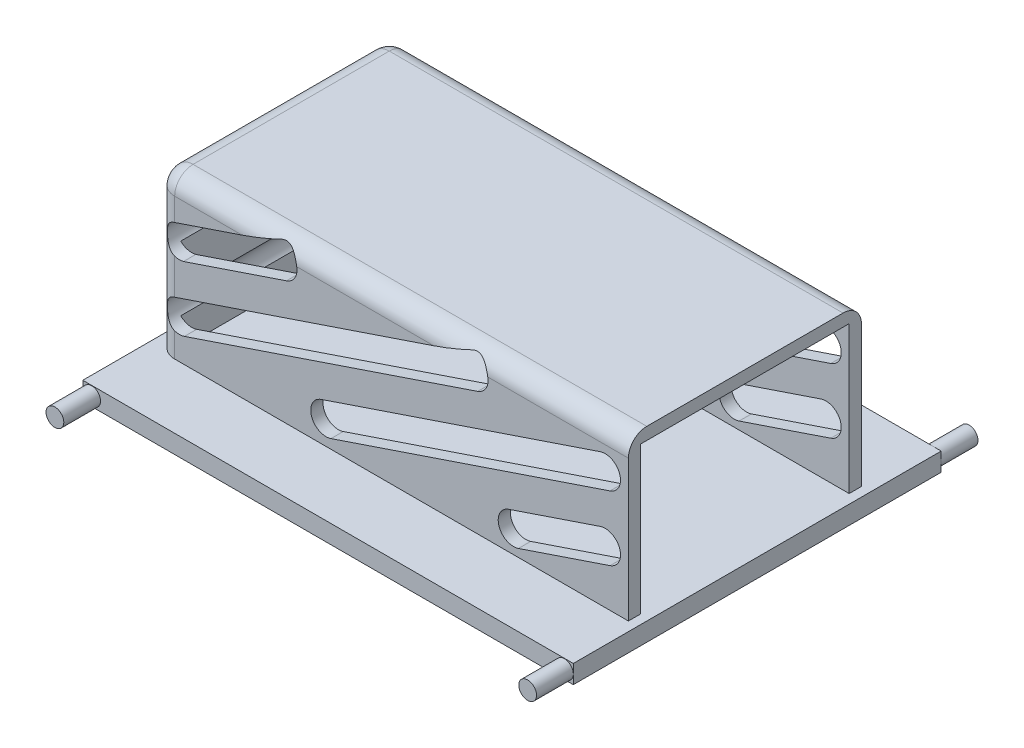
from build123d import *

# Parameters (mm, degrees)
EXTRUDE_1_DEPTH      = 55.815
EXTRUDE_1_DEPTH_BACK = 4.185
EXTRUDE_4_DEPTH      = 24
SKETCH_13_R          = 1.45
EXTRUDE_5_DEPTH      = 6
EXTRUDE_START        = 6
SKETCH_14_R          = 1.45
EXTRUDE_6_DEPTH      = 6
SKETCH_15_W          = 77
SKETCH_15_H          = 37.999949308
EXTRUDE_7_DEPTH      = 2
CUT_EXTRUDE_2_DEPTH  = 38
FILLET_2_R           = 3
FILLET_3_R           = 3
FILLET_4_R           = 3


with BuildPart() as part:
    # 草图1 → 凸台-拉伸1 (new, two sides: drawn at the far end of the back side and taken through both)
    with BuildSketch(Plane.XY.offset(-EXTRUDE_1_DEPTH_BACK)):
        Polygon((0, 1.5), (30, 1.5), (40, 1.5), (40, -1.5), (-40, -1.5), (-40, 1.5), align=None)
    extrude(amount=EXTRUDE_1_DEPTH + EXTRUDE_1_DEPTH_BACK)

    # 草图11 → 凸台-拉伸4 (add)
    with BuildSketch(Plane(origin=(0, 1.5, 0), x_dir=(1, 0, 0), z_dir=(0, 1, 0))):
        Polygon((36.5, -9.329285225), (-36.5, -9.329285225), (-36.5, -43.329234533), (36.5, -43.329234533), (38.5, -43.329234533), (38.5, -45.329234533), (-38.5, -45.329234533), (-38.5, -9.329285225), (-38.5, -7.329285225), (36.5, -7.329285225), (38.5, -7.329285225), (38.5, -9.329285225), align=None)
    extrude(amount=EXTRUDE_4_DEPTH)

    # 草图13 → 凸台-拉伸5 (add)
    with BuildSketch(Plane.XY.offset(55.815)):
        with Locations(Location((-38.55, 0, 0), (0, 0, 180))):
            Circle(SKETCH_13_R)
        with Locations(Location((38.55, 0, 0), (0, 0, 180))):
            Circle(SKETCH_13_R)
    extrude(amount=EXTRUDE_5_DEPTH)

    # 草图14 → 凸台-拉伸6 (add)
    with BuildSketch(Plane(origin=(0, 0, -4.185), x_dir=(-1, 0, 0), z_dir=(0, 0, -1)).offset(EXTRUDE_START)):
        with Locations((-38.55, 0)):
            Circle(SKETCH_14_R)
        with Locations((38.55, 0)):
            Circle(SKETCH_14_R)
    extrude(amount=-EXTRUDE_6_DEPTH)

    # 草图15 → 凸台-拉伸7 (add)
    with BuildSketch(Plane(origin=(0, 25.5, 0), x_dir=(1, 0, 0), z_dir=(0, 1, 0))):
        with Locations((0, -26.329259879)):
            Rectangle(SKETCH_15_W, SKETCH_15_H)
    extrude(amount=EXTRUDE_7_DEPTH)

    # 草图16 → 切除-拉伸2 (cut)
    with BuildSketch(Plane.XY.offset(45.329234533)):
        with BuildLine():
            Line((-18.734540656, 26.451398681), (-35.362355257, 20.836811932))
            ThreePointArc((-35.362355257, 20.836811932), (-37.12868865, 17.766202685), (-34.058079403, 15.999869293))
            Line((-34.058079403, 15.999869293), (-17.260126249, 21.671905422))
            ThreePointArc((-17.260126249, 21.671905422), (-15.664993145, 24.781150117), (-18.734540656, 26.451398681))
        make_face()
        with BuildLine():
            Line((-35.510009127, 10.232259834), (12.313007681, 26.380291484))
            ThreePointArc((12.313007681, 26.380291484), (15.481413648, 24.811469112), (13.912591276, 21.643063146))
            Line((13.912591276, 21.643063146), (-33.910425533, 5.495031496))
            ThreePointArc((-33.910425533, 5.495031496), (-37.078831499, 7.063853868), (-35.510009127, 10.232259834))
        make_face()
        with BuildLine():
            Line((-11.608912214, 7.748065143), (33.910425533, 23.118231136))
            ThreePointArc((33.910425533, 23.118231136), (37.078831499, 21.549408764), (35.510009127, 18.381002798))
            Line((35.510009127, 18.381002798), (-10.009328619, 3.010836806))
            ThreePointArc((-10.009328619, 3.010836806), (-13.177734585, 4.579659177), (-11.608912214, 7.748065143))
        make_face()
        with BuildLine():
            Line((18.964604183, 7.516895213), (33.910425533, 12.563536189))
            ThreePointArc((33.910425533, 12.563536189), (37.078831499, 10.994713817), (35.510009127, 7.826307851))
            Line((35.510009127, 7.826307851), (20.564187778, 2.779666876))
            ThreePointArc((20.564187778, 2.779666876), (17.395781811, 4.348489247), (18.964604183, 7.516895213))
        make_face()
    extrude(amount=-CUT_EXTRUDE_2_DEPTH, mode=Mode.SUBTRACT)

    # 圆角2
    fillet_2_edges = [part.edges().sort_by_distance(p)[0] for p in [
        (-38.5, 27.5, 26.329259879),
    ]]
    fillet(fillet_2_edges, radius=FILLET_2_R)

    # 圆角3
    # the kernel refuses this fillet: 3 mm, written as the material it takes off along each edge
    with BuildSketch(Plane(origin=(-38.5, 1.5, 7.329285225), x_dir=(1, 0, 0), z_dir=(0, 1, 0))) as fillet_3_piece_1:
        with BuildLine():
            CenterArc((FILLET_3_R, -FILLET_3_R), FILLET_3_R, 90, 90)
            Line((0, -FILLET_3_R), (0, 0))
            Line((0, 0), (FILLET_3_R, 0))
        make_face()
    extrude(amount=23, mode=Mode.SUBTRACT)
    with BuildSketch(Plane(origin=(-35.5, 24.5, 7.329285225), x_dir=(-1, 0, 0), z_dir=(0, -1, 0))) as fillet_3_piece_2:
        with BuildLine():
            CenterArc((3 - FILLET_3_R, -FILLET_3_R), FILLET_3_R, 0, 90)
            Line((3, -FILLET_3_R), (3, 0))
            Line((3, 0), (3 - FILLET_3_R, 0))
        make_face()
    revolve(axis=Axis((-35.5, 24.5, 7.329285225), (0, 0, -1)), revolution_arc=90, mode=Mode.SUBTRACT)
    with BuildSketch(Plane(origin=(46, 27.5, 7.329285225), x_dir=(0, -1, 0), z_dir=(-1, 0, 0))) as fillet_3_piece_3:
        with BuildLine():
            CenterArc((FILLET_3_R, FILLET_3_R), FILLET_3_R, 180, 90)
            Line((0, FILLET_3_R), (0, 0))
            Line((0, 0), (FILLET_3_R, 0))
        make_face()
    extrude(amount=81.5, mode=Mode.SUBTRACT)

    # 圆角4
    # the kernel refuses this fillet: 3 mm, written as the material it takes off along each edge
    with BuildSketch(Plane(origin=(-35.5, 27.5, 45.329234533), x_dir=(0, -1, 0), z_dir=(1, 0, 0))) as fillet_4_piece_1:
        with BuildLine():
            CenterArc((FILLET_4_R, FILLET_4_R), FILLET_4_R, 180, 90)
            Line((0, FILLET_4_R), (0, 0))
            Line((0, 0), (FILLET_4_R, 0))
        make_face()
    extrude(amount=81.5, mode=Mode.SUBTRACT)
    with BuildSketch(Plane(origin=(-38.5, 1.5, 45.329234533), x_dir=(1, 0, 0), z_dir=(0, 1, 0))) as fillet_4_piece_2:
        with BuildLine():
            CenterArc((FILLET_4_R, FILLET_4_R), FILLET_4_R, 180, 90)
            Line((0, FILLET_4_R), (0, 0))
            Line((0, 0), (FILLET_4_R, 0))
        make_face()
    extrude(amount=23, mode=Mode.SUBTRACT)
    with BuildSketch(Plane(origin=(-35.5, 24.5, 45.329234533), x_dir=(-1, 0, 0), z_dir=(0, -1, 0))) as fillet_4_piece_3:
        with BuildLine():
            CenterArc((3 - FILLET_4_R, FILLET_4_R), FILLET_4_R, 270, 90)
            Line((3, FILLET_4_R), (3, 0))
            Line((3, 0), (3 - FILLET_4_R, 0))
        make_face()
    revolve(axis=Axis((-35.5, 24.5, 45.329234533), (0, 0, -1)), revolution_arc=90, mode=Mode.SUBTRACT)


solid = part.part
